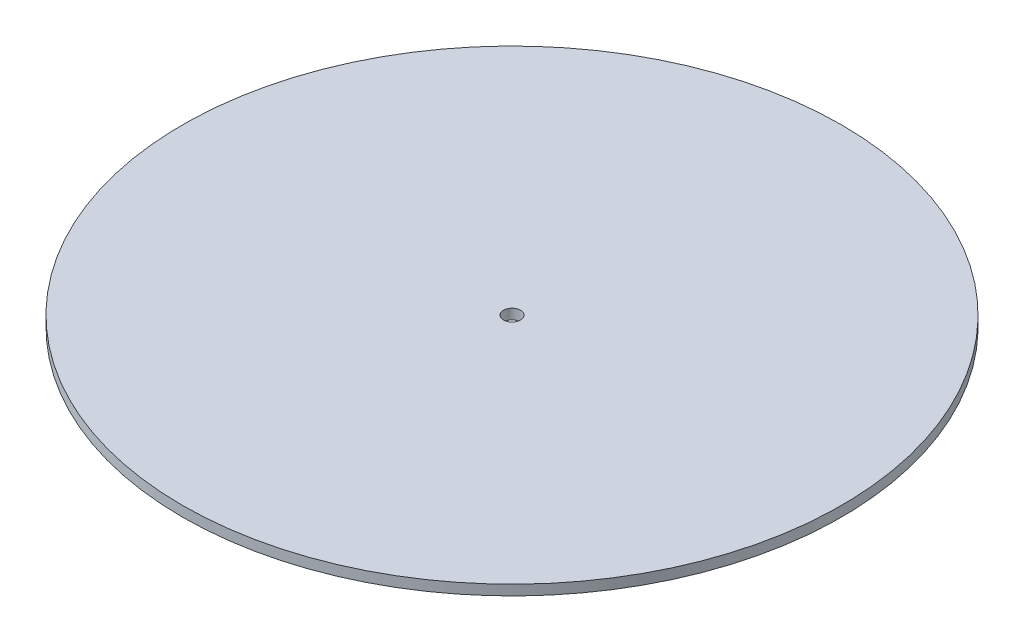
from build123d import *

# Parameters (mm, degrees)
ESQUISSE2_W             = 97
ESQUISSE2_H             = 3
ESQUISSE4_R             = 2.5
ENL_V_MAT_EXTRU_6_DEPTH = 138.211515552


with BuildPart() as part:
    # Esquisse2 → Révolution1 (revolve)
    with BuildSketch(Plane.XY):
        with Locations((48.5, 1.5)):
            Rectangle(ESQUISSE2_W, ESQUISSE2_H)
    revolve(axis=Axis((0, 55, 0), (0, -1, 0)))

    # Esquisse4 → Enlèv. mat.-Extru.6 (cut, through all)
    with BuildSketch(Plane(origin=(0, 3, 0), x_dir=(1, 0, 0), z_dir=(0, 1, 0))):
        Circle(ESQUISSE4_R)
    extrude(amount=-ENL_V_MAT_EXTRU_6_DEPTH, mode=Mode.SUBTRACT)


solid = part.part
